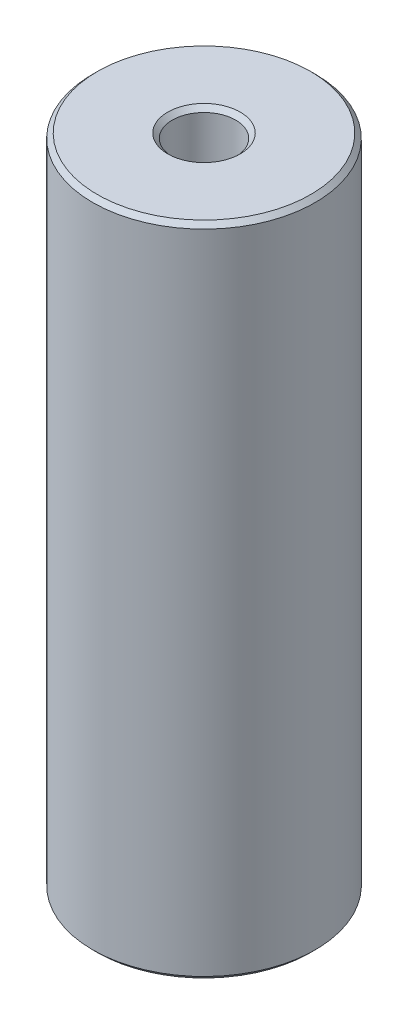
from build123d import *

# Parameters (mm, degrees)
SKETCH1_R           = 5
BOSS_EXTRUDE1_DEPTH = 29.503230343
SKETCH2_R           = 1.423358713
CUT_EXTRUDE1_DEPTH  = 31.338763994
CHAMFER1_SIZE       = 0.206618048


with BuildPart() as part:
    # Sketch1 → Boss-Extrude1 (new body)
    with BuildSketch(Plane(origin=(0, 0, 0), x_dir=(1, 0, 0), z_dir=(0, 1, 0))):
        Circle(SKETCH1_R)
    extrude(amount=BOSS_EXTRUDE1_DEPTH)

    # Sketch2 → Cut-Extrude1 (cut, through all)
    with BuildSketch(Plane(origin=(0, 0, 0), x_dir=(1, 0, 0), z_dir=(0, 1, 0))):
        Circle(SKETCH2_R)
    extrude(amount=CUT_EXTRUDE1_DEPTH, mode=Mode.SUBTRACT)

    # Chamfer1
    chamfer1_edges = [part.edges().sort_by_distance(p)[0] for p in [
        (-1.423358713, 29.503230343, 0),
        (-1.423358713, 0, 0),
        (-5, 0, 0),
        (-5, 29.503230343, 0),
    ]]
    chamfer(chamfer1_edges, length=CHAMFER1_SIZE)


solid = part.part
